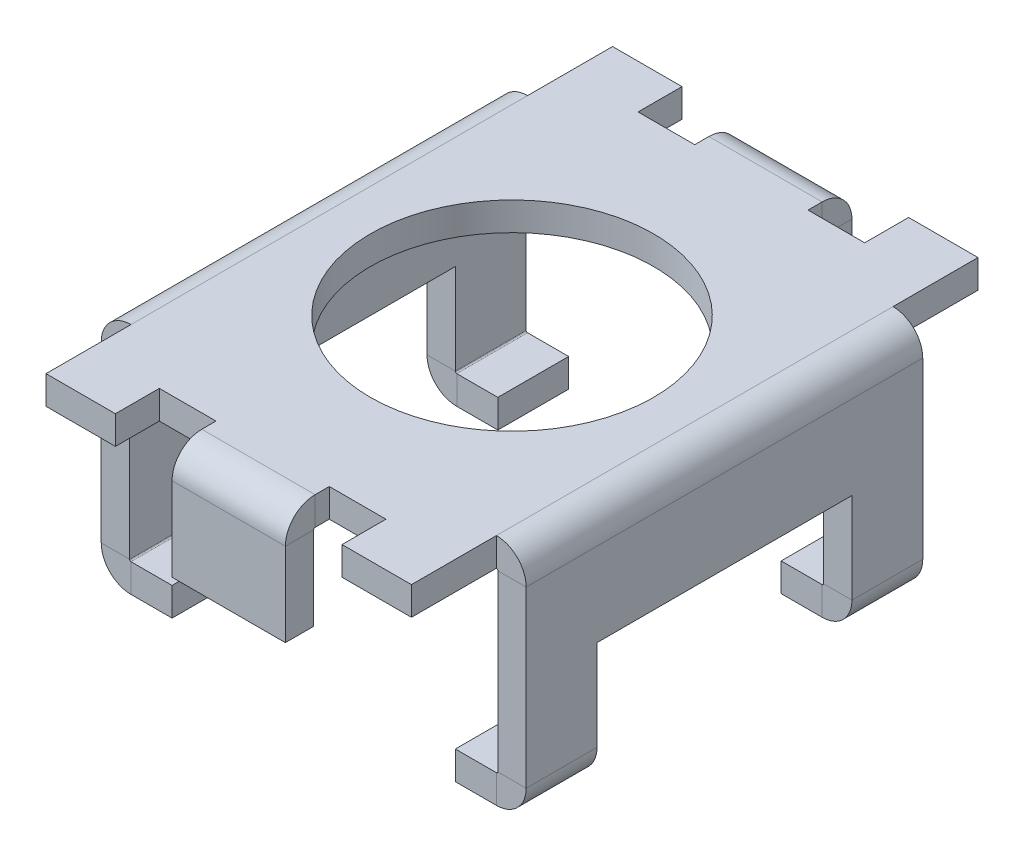
from build123d import *

# Parameters (mm, degrees)
SKETCH1_W                       = 3
SKETCH1_H                       = 4
BASE_FLANGE1_DEPTH              = 0.2
EDGE_FLANGE1_STRIP_W            = 0.82
EDGE_FLANGE1_STRIP_H            = 0.2
EDGE_FLANGE1_STRIP_CUT_DEPTH    = 0.8
EDGE_FLANGE1_RELIEF_W           = 0.92
EDGE_FLANGE1_RELIEF_H           = 0.4
EDGE_FLANGE1_RELIEF_CUT_DEPTH   = 0.2
EDGE_FLANGE1_STRIP_2_W          = 0.82
EDGE_FLANGE1_STRIP_2_H          = 0.2
EDGE_FLANGE1_STRIP_CUT_2_DEPTH  = 0.8
EDGE_FLANGE1_RELIEF_2_W         = 0.92
EDGE_FLANGE1_RELIEF_2_H         = 0.4
EDGE_FLANGE1_RELIEF_CUT_2_DEPTH = 0.2
EDGE_FLANGE1_DEPTH              = 0.8
EDGE_FLANGE1_BEND_DEPTH         = 0.8
EDGE_FLANGE2_STRIP_W            = 0.82
EDGE_FLANGE2_STRIP_H            = 0.2
EDGE_FLANGE2_STRIP_CUT_DEPTH    = 2.8
EDGE_FLANGE2_RELIEF_W           = 0.82
EDGE_FLANGE2_RELIEF_H           = 0.6
EDGE_FLANGE2_RELIEF_CUT_DEPTH   = 0.2
EDGE_FLANGE2_STRIP_2_W          = 0.82
EDGE_FLANGE2_STRIP_2_H          = 0.2
EDGE_FLANGE2_STRIP_CUT_2_DEPTH  = 2.8
EDGE_FLANGE2_RELIEF_2_W         = 0.82
EDGE_FLANGE2_RELIEF_2_H         = 0.6
EDGE_FLANGE2_RELIEF_CUT_2_DEPTH = 0.2
EDGE_FLANGE2_DEPTH              = 2.8
EDGE_FLANGE2_BEND_DEPTH         = 2.8
EDGE_FLANGE3_STRIP_W            = 0.82
EDGE_FLANGE3_STRIP_H            = 0.2
EDGE_FLANGE3_STRIP_CUT_DEPTH    = 2.8
EDGE_FLANGE3_STRIP_2_W          = 0.82
EDGE_FLANGE3_STRIP_2_H          = 0.2
EDGE_FLANGE3_STRIP_CUT_2_DEPTH  = 2.8
EDGE_FLANGE3_DEPTH              = 2.8
EDGE_FLANGE3_BEND_DEPTH         = 2.8
CUT_EXTRUDE1_DEPTH              = 10
CUT_EXTRUDE1_DEPTH_BACK         = 10
SKETCH23_W                      = 1.8
SKETCH23_H                      = 0.85
SKETCH24_R                      = 1
CUT_EXTRUDE2_DEPTH              = 10


# Sheet-metal steps are written as plain solids
with BuildPart() as part:
    # Sketch1 → Base-Flange1 (new body)
    with BuildSketch(Plane(origin=(0, 0, 0), x_dir=(1, 0, 0), z_dir=(0, 1, 0))):
        Rectangle(SKETCH1_W, SKETCH1_H)
    extrude(amount=-BASE_FLANGE1_DEPTH)

    # Edge-Flange1 strip (across the edge) → Edge-Flange1 strip cut (cut)
    with BuildSketch(Plane(origin=(0.4, -0.2, 2), x_dir=(0, 0, -1), z_dir=(-1, 0, 0))):
        with Locations((-0.2, -0.1)):
            Rectangle(EDGE_FLANGE1_STRIP_W, EDGE_FLANGE1_STRIP_H)
    extrude(amount=EDGE_FLANGE1_STRIP_CUT_DEPTH, mode=Mode.SUBTRACT)

    # Edge-Flange1 relief (on the sheet) → Edge-Flange1 relief cut (cut)
    with BuildSketch(Plane(origin=(0.4, -0.2, 1.79), x_dir=(0, 0, -1), z_dir=(0, -1, 0))):
        with Locations((-0.36, 0.2)):
            Rectangle(EDGE_FLANGE1_RELIEF_W, EDGE_FLANGE1_RELIEF_H)
        with Locations((-0.36, -1)):
            Rectangle(EDGE_FLANGE1_RELIEF_W, EDGE_FLANGE1_RELIEF_H)
    extrude(amount=-EDGE_FLANGE1_RELIEF_CUT_DEPTH, mode=Mode.SUBTRACT)

    # Edge-Flange1 strip 2 (across the edge) → Edge-Flange1 strip cut 2 (cut)
    with BuildSketch(Plane(origin=(-0.4, -0.2, -2), x_dir=(0, 0, 1), z_dir=(1, 0, 0))):
        with Locations((-0.2, -0.1)):
            Rectangle(EDGE_FLANGE1_STRIP_2_W, EDGE_FLANGE1_STRIP_2_H)
    extrude(amount=EDGE_FLANGE1_STRIP_CUT_2_DEPTH, mode=Mode.SUBTRACT)

    # Edge-Flange1 relief 2 (on the sheet) → Edge-Flange1 relief cut 2 (cut)
    with BuildSketch(Plane(origin=(-0.4, -0.2, -1.79), x_dir=(0, 0, 1), z_dir=(0, -1, 0))):
        with Locations((-0.36, 0.2)):
            Rectangle(EDGE_FLANGE1_RELIEF_2_W, EDGE_FLANGE1_RELIEF_2_H)
        with Locations((-0.36, -1)):
            Rectangle(EDGE_FLANGE1_RELIEF_2_W, EDGE_FLANGE1_RELIEF_2_H)
    extrude(amount=-EDGE_FLANGE1_RELIEF_CUT_2_DEPTH, mode=Mode.SUBTRACT)

    # Edge-Flange1 section (across the edge) → Edge-Flange1 (add)
    with BuildSketch(Plane(origin=(0.4, -0.2, 2), x_dir=(0, 0, -1), z_dir=(-1, 0, 0))):
        with BuildLine():
            Line((0, 0.01), (0, 0.6))
            Line((0, 0.6), (0.2, 0.6))
            Line((0.2, 0.6), (0.2, 0.01))
            ThreePointArc((0.2, 0.01), (0.202928932, 0.002928932), (0.21, 0))
            Line((0.21, 0), (0.21, -0.2))
            ThreePointArc((0.21, -0.2), (0.061507576, -0.138492424), (0, 0.01))
        make_face()
    extrude(amount=EDGE_FLANGE1_DEPTH)

    # Edge-Flange1 section 2 (across the edge) → Edge-Flange1 bend (add)
    with BuildSketch(Plane(origin=(-0.4, -0.2, -2), x_dir=(0, 0, 1), z_dir=(1, 0, 0))):
        with BuildLine():
            Line((0, 0.01), (0, 0.6))
            Line((0, 0.6), (0.2, 0.6))
            Line((0.2, 0.6), (0.2, 0.01))
            ThreePointArc((0.2, 0.01), (0.202928932, 0.002928932), (0.21, 0))
            Line((0.21, 0), (0.21, -0.2))
            ThreePointArc((0.21, -0.2), (0.061507576, -0.138492424), (0, 0.01))
        make_face()
    extrude(amount=EDGE_FLANGE1_BEND_DEPTH)

    # Edge-Flange2 strip (across the edge) → Edge-Flange2 strip cut (cut)
    with BuildSketch(Plane(origin=(-1.5, -0.2, 1.4), x_dir=(1, 0, 0), z_dir=(0, 0, -1))):
        with Locations((-0.2, -0.1)):
            Rectangle(EDGE_FLANGE2_STRIP_W, EDGE_FLANGE2_STRIP_H)
    extrude(amount=EDGE_FLANGE2_STRIP_CUT_DEPTH, mode=Mode.SUBTRACT)

    # Edge-Flange2 relief (on the sheet) → Edge-Flange2 relief cut (cut)
    with BuildSketch(Plane(origin=(-1.29, -0.2, 1.4), x_dir=(1, 0, 0), z_dir=(0, -1, 0))):
        with Locations((-0.41, 0.3)):
            Rectangle(EDGE_FLANGE2_RELIEF_W, EDGE_FLANGE2_RELIEF_H)
        with Locations((-0.41, -3.1)):
            Rectangle(EDGE_FLANGE2_RELIEF_W, EDGE_FLANGE2_RELIEF_H)
    extrude(amount=-EDGE_FLANGE2_RELIEF_CUT_DEPTH, mode=Mode.SUBTRACT)

    # Edge-Flange2 strip 2 (across the edge) → Edge-Flange2 strip cut 2 (cut)
    with BuildSketch(Plane(origin=(1.5, -0.2, -1.4), x_dir=(-1, 0, 0), z_dir=(0, 0, 1))):
        with Locations((-0.2, -0.1)):
            Rectangle(EDGE_FLANGE2_STRIP_2_W, EDGE_FLANGE2_STRIP_2_H)
    extrude(amount=EDGE_FLANGE2_STRIP_CUT_2_DEPTH, mode=Mode.SUBTRACT)

    # Edge-Flange2 relief 2 (on the sheet) → Edge-Flange2 relief cut 2 (cut)
    with BuildSketch(Plane(origin=(1.29, -0.2, -1.4), x_dir=(-1, 0, 0), z_dir=(0, -1, 0))):
        with Locations((-0.41, 0.3)):
            Rectangle(EDGE_FLANGE2_RELIEF_2_W, EDGE_FLANGE2_RELIEF_2_H)
        with Locations((-0.41, -3.1)):
            Rectangle(EDGE_FLANGE2_RELIEF_2_W, EDGE_FLANGE2_RELIEF_2_H)
    extrude(amount=-EDGE_FLANGE2_RELIEF_CUT_2_DEPTH, mode=Mode.SUBTRACT)

    # Edge-Flange2 section (across the edge) → Edge-Flange2 (add)
    with BuildSketch(Plane(origin=(-1.5, -0.2, 1.4), x_dir=(1, 0, 0), z_dir=(0, 0, -1))):
        with BuildLine():
            Line((0, 0.01), (0, 1.45))
            Line((0, 1.45), (0.2, 1.45))
            Line((0.2, 1.45), (0.2, 0.01))
            ThreePointArc((0.2, 0.01), (0.202928932, 0.002928932), (0.21, 0))
            Line((0.21, 0), (0.21, -0.2))
            ThreePointArc((0.21, -0.2), (0.061507576, -0.138492424), (0, 0.01))
        make_face()
    extrude(amount=EDGE_FLANGE2_DEPTH)

    # Edge-Flange2 section 2 (across the edge) → Edge-Flange2 bend (add)
    with BuildSketch(Plane(origin=(1.5, -0.2, -1.4), x_dir=(-1, 0, 0), z_dir=(0, 0, 1))):
        with BuildLine():
            Line((0, 0.01), (0, 1.45))
            Line((0, 1.45), (0.2, 1.45))
            Line((0.2, 1.45), (0.2, 0.01))
            ThreePointArc((0.2, 0.01), (0.202928932, 0.002928932), (0.21, 0))
            Line((0.21, 0), (0.21, -0.2))
            ThreePointArc((0.21, -0.2), (0.061507576, -0.138492424), (0, 0.01))
        make_face()
    extrude(amount=EDGE_FLANGE2_BEND_DEPTH)

    # Edge-Flange3 strip (across the edge) → Edge-Flange3 strip cut (cut)
    with BuildSketch(Plane(origin=(-1.3, -1.65, 1.4), x_dir=(0, 1, 0), z_dir=(0, 0, -1))):
        with Locations((-0.2, -0.1)):
            Rectangle(EDGE_FLANGE3_STRIP_W, EDGE_FLANGE3_STRIP_H)
    extrude(amount=EDGE_FLANGE3_STRIP_CUT_DEPTH, mode=Mode.SUBTRACT)

    # Edge-Flange3 strip 2 (across the edge) → Edge-Flange3 strip cut 2 (cut)
    with BuildSketch(Plane(origin=(1.3, -1.65, -1.4), x_dir=(0, 1, 0), z_dir=(0, 0, 1))):
        with Locations((-0.2, -0.1)):
            Rectangle(EDGE_FLANGE3_STRIP_2_W, EDGE_FLANGE3_STRIP_2_H)
    extrude(amount=EDGE_FLANGE3_STRIP_CUT_2_DEPTH, mode=Mode.SUBTRACT)

    # Edge-Flange3 section (across the edge) → Edge-Flange3 (add)
    with BuildSketch(Plane(origin=(-1.3, -1.65, 1.4), x_dir=(0, 1, 0), z_dir=(0, 0, -1))):
        with BuildLine():
            Line((0, 0.01), (0, 0.3))
            Line((0, 0.3), (0.2, 0.3))
            Line((0.2, 0.3), (0.2, 0.01))
            ThreePointArc((0.2, 0.01), (0.202928932, 0.002928932), (0.21, 0))
            Line((0.21, 0), (0.21, -0.2))
            ThreePointArc((0.21, -0.2), (0.061507576, -0.138492424), (0, 0.01))
        make_face()
    extrude(amount=EDGE_FLANGE3_DEPTH)

    # Edge-Flange3 section 2 (across the edge) → Edge-Flange3 bend (add)
    with BuildSketch(Plane(origin=(1.3, -1.65, -1.4), x_dir=(0, 1, 0), z_dir=(0, 0, 1))):
        with BuildLine():
            Line((0, 0.01), (0, 0.3))
            Line((0, 0.3), (0.2, 0.3))
            Line((0.2, 0.3), (0.2, 0.01))
            ThreePointArc((0.2, 0.01), (0.202928932, 0.002928932), (0.21, 0))
            Line((0.21, 0), (0.21, -0.2))
            ThreePointArc((0.21, -0.2), (0.061507576, -0.138492424), (0, 0.01))
        make_face()
    extrude(amount=EDGE_FLANGE3_BEND_DEPTH)

    # Sketch23 → Cut-Extrude1 (cut, two sides: drawn at the far end of the back side and taken through both)
    with BuildSketch(Plane(origin=(0, 0, 0), x_dir=(0, 0, -1), z_dir=(1, 0, 0)).offset(-CUT_EXTRUDE1_DEPTH_BACK)):
        with Locations((0, -1.225)):
            Rectangle(SKETCH23_W, SKETCH23_H)
    extrude(amount=CUT_EXTRUDE1_DEPTH + CUT_EXTRUDE1_DEPTH_BACK, mode=Mode.SUBTRACT)

    # Sketch24 → Cut-Extrude2 (cut)
    with BuildSketch(Plane(origin=(0, 0, 0), x_dir=(1, 0, 0), z_dir=(0, 1, 0))):
        with Locations(Location((0, 0, 0), (0, 0, 270))):
            Circle(SKETCH24_R)
    extrude(amount=-CUT_EXTRUDE2_DEPTH, mode=Mode.SUBTRACT)


solid = part.part
